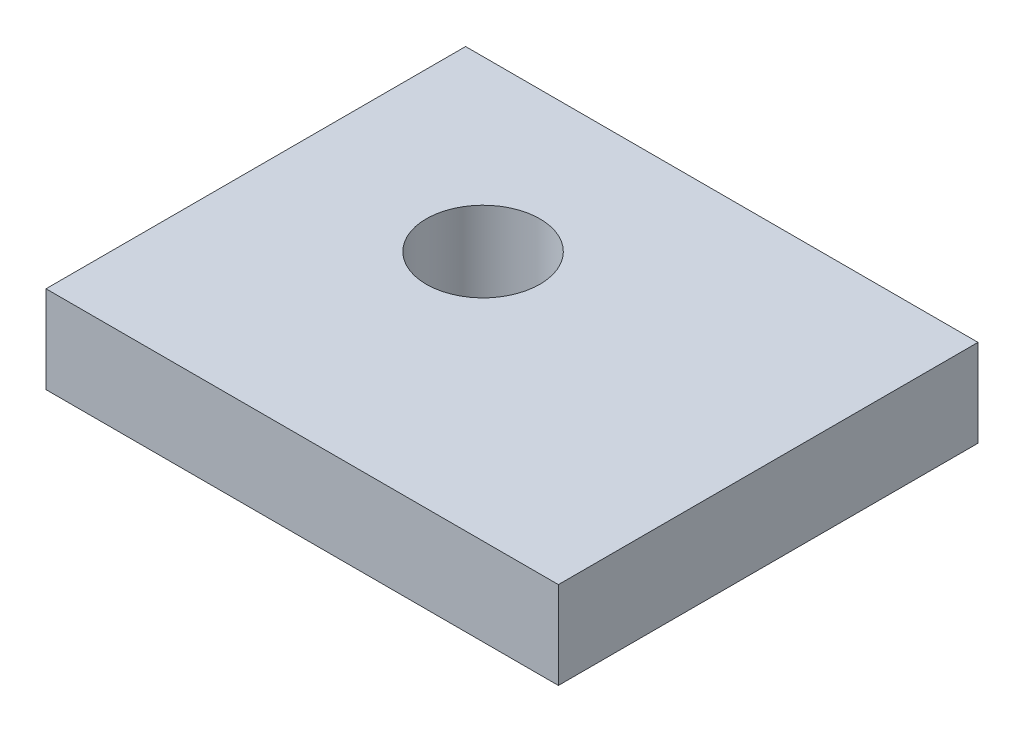
from build123d import *

# Parameters (mm, degrees)
SKETCH3_W           = 37.239999942
SKETCH3_H           = 30.495
SKETCH3_R           = 4.127
BOSS_EXTRUDE1_DEPTH = 6.35


with BuildPart() as part:
    # Sketch3 → Boss-Extrude1 (new body)
    with BuildSketch(Plane(origin=(0, 0, 0), x_dir=(1, 0, 0), z_dir=(0, 1, 0))):
        with Locations((18.619999971, -15.2475)):
            Rectangle(SKETCH3_W, SKETCH3_H)
        with Locations((13.54, -12.27)):
            Circle(SKETCH3_R, mode=Mode.SUBTRACT)
    extrude(amount=BOSS_EXTRUDE1_DEPTH)


solid = part.part
